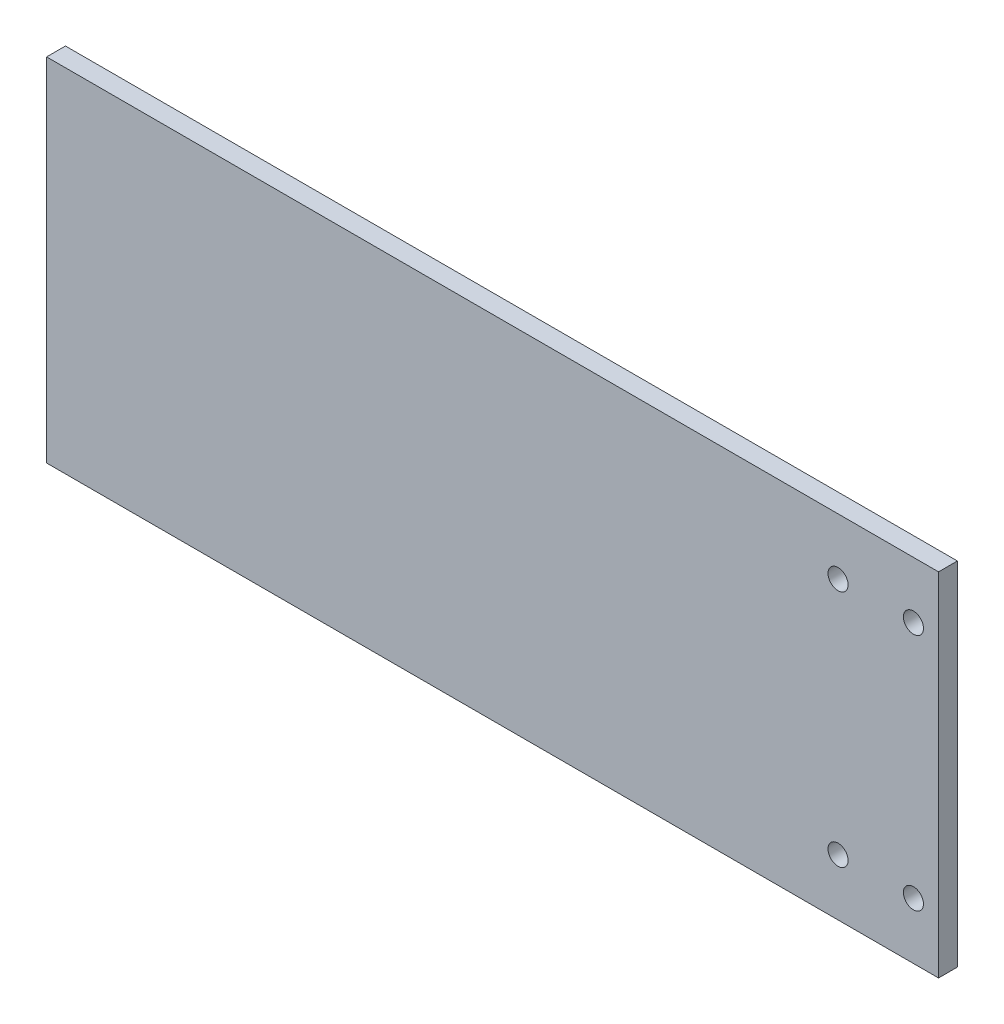
from build123d import *

# Parameters (mm, degrees)
SKETCH2_W           = 142
SKETCH2_H           = 56
BOSS_EXTRUDE1_DEPTH = 3
SKETCH3_R           = 1.6
CUT_EXTRUDE1_DEPTH  = 91.493093659


with BuildPart() as part:
    # Sketch2 → Boss-Extrude1 (new body)
    with BuildSketch(Plane.XY):
        with Locations((15, 0)):
            Rectangle(SKETCH2_W, SKETCH2_H)
    extrude(amount=BOSS_EXTRUDE1_DEPTH)

    # Sketch3 → Cut-Extrude1 (cut, through all)
    with BuildSketch(Plane.XY.offset(3)):
        with Locations((82, 19)):
            Circle(SKETCH3_R)
        with Locations((82, -19)):
            Circle(SKETCH3_R)
        with Locations((70, 19)):
            Circle(SKETCH3_R)
        with Locations((70, -19)):
            Circle(SKETCH3_R)
    extrude(amount=-CUT_EXTRUDE1_DEPTH, mode=Mode.SUBTRACT)


solid = part.part
